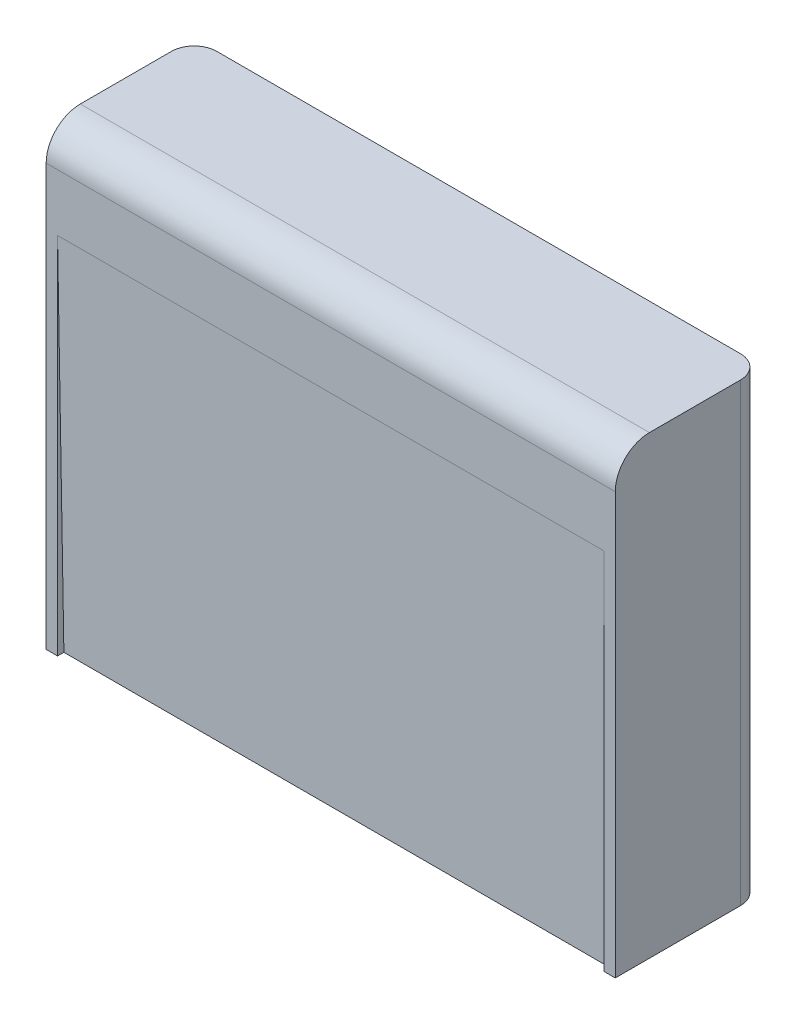
from build123d import *

# Parameters (mm, degrees)
SKETCH1_W                   = 50
SKETCH1_H                   = 13
BOSS_EXTRUDE1_DEPTH         = 40
FILLET1_R                   = 2
FILLET2_R                   = 3
M6_TAPPED_HOLE1_D           = 5
M6_TAPPED_HOLE1_DEPTH       = 17
M6_TAPPED_HOLE1_CSINK_D     = 6.05
M6_TAPPED_HOLE1_CSINK_ANGLE = 90
M6_TAPPED_HOLE1_TIP         = 1.502151548
CUT_EXTRUDE1_DEPTH          = 24


with BuildPart() as part:
    # Sketch1 → Boss-Extrude1 (new body)
    with BuildSketch(Plane(origin=(0, 0, 0), x_dir=(1, 0, 0), z_dir=(0, 1, 0))):
        Rectangle(SKETCH1_W, SKETCH1_H)
    extrude(amount=-BOSS_EXTRUDE1_DEPTH)

    # Fillet1
    fillet1_edges = [part.edges().sort_by_distance(p)[0] for p in [
        (-25, -20, -6.5),
        (25, -20, -6.5),
    ]]
    fillet(fillet1_edges, radius=FILLET1_R)

    # Fillet2
    fillet2_edges = [part.edges().sort_by_distance(p)[0] for p in [
        (0, 0, 6.5),
    ]]
    fillet(fillet2_edges, radius=FILLET2_R)

    # M6 Tapped Hole1
    with Locations(Plane(origin=(0, -40, 0), x_dir=(-1, 0, 0), z_dir=(0, -1, 0))):
        with Locations((-17.5, 0), (17.5, 0)):
            CounterSinkHole(M6_TAPPED_HOLE1_D / 2, M6_TAPPED_HOLE1_CSINK_D / 2, depth=M6_TAPPED_HOLE1_DEPTH, counter_sink_angle=M6_TAPPED_HOLE1_CSINK_ANGLE)
            with Locations((0, 0, -(M6_TAPPED_HOLE1_DEPTH + M6_TAPPED_HOLE1_TIP / 2))):  # 118° drill point
                Cone(0, M6_TAPPED_HOLE1_D / 2, M6_TAPPED_HOLE1_TIP, mode=Mode.SUBTRACT)

    # Sketch5 → Cut-Extrude1 (cut, symmetric)
    with BuildSketch(Plane(origin=(0, 0, 0), x_dir=(0, 0, -1), z_dir=(1, 0, 0))):
        Polygon((-6.5, -8), (-5.941437922, -40), (-6.5, -40), align=None)
    extrude(amount=CUT_EXTRUDE1_DEPTH, both=True, mode=Mode.SUBTRACT)


solid = part.part
